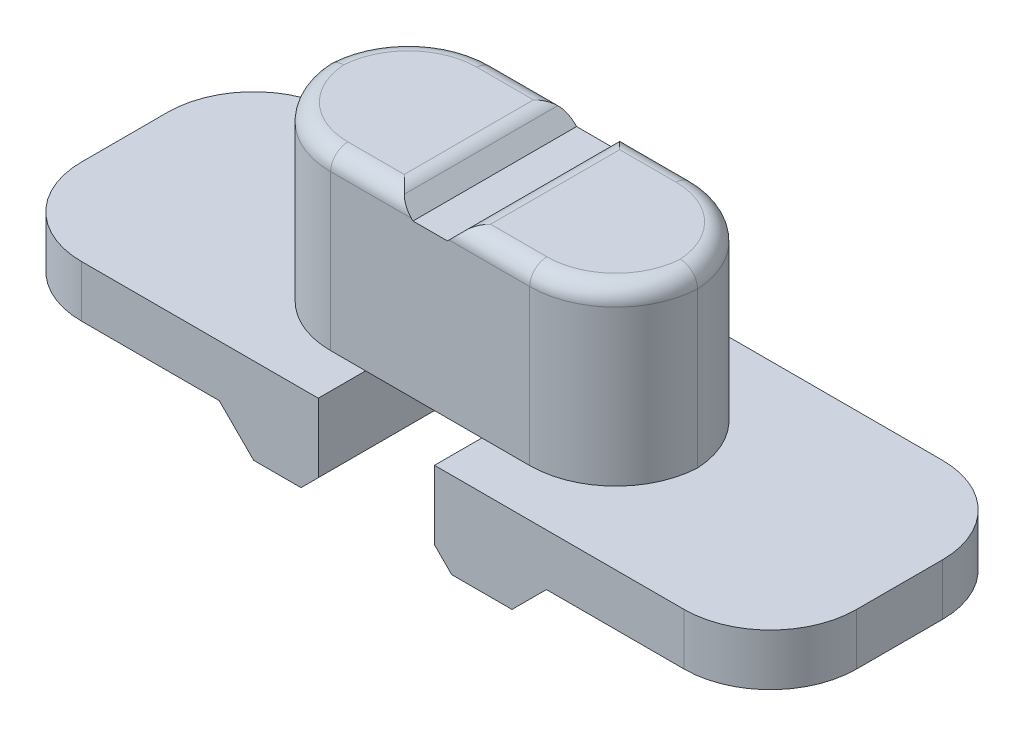
from build123d import *

# Parameters (mm, degrees)
SKETCH_1_W                      = 9
SKETCH_1_H                      = 3
EXTRUDE_1_DEPTH                 = 0.6
SKETCH_2_W                      = 4.311420348
SKETCH_2_H                      = 1.9
EXTRUDE_2_DEPTH                 = 2
FILLET_1_R                      = 1
SKETCH_3_W                      = 3
SKETCH_3_H                      = 3
EXTRUDE_3_DEPTH                 = 0.4
CHAMFER_1_SIZE                  = 0.4
CUT_EXTRUDE_1_REACH             = 8.365
SKETCH_5_W                      = 1.35
SKETCH_5_H                      = 1
CHAMFER_2_SIZE                  = 0.2
CUT_EXTRUDE_2_REACH             = 8.125
SKETCH_7_W                      = 1
SKETCH_7_H                      = 0.436396564
CUT_EXTRUDE_2_DIRECTION_2_DEPTH = 7.124593071
CHAMFER_3_SIZE                  = 0.3
FILLET_2_R                      = 0.2


# Some blends are built 0.0001 mm under size
with BuildPart() as part:
    # 草图1 → 凸台-拉伸1 (new body)
    with BuildSketch(Plane(origin=(0, 0, 0), x_dir=(1, 0, 0), z_dir=(0, 1, 0))):
        with Locations((0.474750274, 0.443619988)):
            Rectangle(SKETCH_1_W, SKETCH_1_H)
    extrude(amount=EXTRUDE_1_DEPTH)

    # 草图2 → 凸台-拉伸2 (add)
    with BuildSketch(Plane(origin=(0, 0.6, 0), x_dir=(1, 0, 0), z_dir=(0, 1, 0))):
        with Locations((0.474750274, 0.443619988)):
            Rectangle(SKETCH_2_W, SKETCH_2_H)
    extrude(amount=EXTRUDE_2_DEPTH)

    # 圆角1
    # the kernel refuses this fillet: 1 mm, written as the material it takes off along each edge
    with BuildSketch(Plane(origin=(-4.025249726, -2.5, 1.056380012), x_dir=(0, 0, -1), z_dir=(0, 1, 0)), Plane(origin=(-4.025249726, -2.5, -1.943619988), x_dir=(1, 0, 0), z_dir=(0, 1, 0))) as fillet_1_piece_1:
        with BuildLine():
            CenterArc((FILLET_1_R, -FILLET_1_R), FILLET_1_R, 90, 90)
            Line((0, -FILLET_1_R), (0, 0))
            Line((0, 0), (FILLET_1_R, 0))
        make_face()
    extrude(amount=5.6, mode=Mode.SUBTRACT)
    with BuildSketch(Plane(origin=(-1.6809599, 0.6, 0.506380012), x_dir=(1, 0, 0), z_dir=(0, 1, 0)), Plane(origin=(2.630460448, 0.6, 0.506380012), x_dir=(0, 0, -1), z_dir=(0, 1, 0)), Plane(origin=(2.630460448, 0.6, -1.393619988), x_dir=(-1, 0, 0), z_dir=(0, 1, 0))) as fillet_1_piece_2:
        with BuildLine():
            CenterArc((FILLET_1_R, FILLET_1_R), FILLET_1_R, 180, 90)
            Line((0, FILLET_1_R), (0, 0))
            Line((0, 0), (FILLET_1_R, 0))
        make_face()
    extrude(amount=4.5, mode=Mode.SUBTRACT)
    with BuildSketch(Plane(origin=(4.974750274, -2.5, 1.056380012), x_dir=(0, 0, -1), z_dir=(0, 1, 0)), Plane(origin=(4.974750274, -2.5, -1.943619988), x_dir=(-1, 0, 0), z_dir=(0, 1, 0))) as fillet_1_piece_3:
        with BuildLine():
            CenterArc((FILLET_1_R, FILLET_1_R), FILLET_1_R, 180, 90)
            Line((0, FILLET_1_R), (0, 0))
            Line((0, 0), (FILLET_1_R, 0))
        make_face()
    extrude(amount=5.6, mode=Mode.SUBTRACT)
    with BuildSketch(Plane(origin=(-1.6809599, 0.6, -1.393619988), x_dir=(1, 0, 0), z_dir=(0, 1, 0))) as fillet_1_piece_4:
        with BuildLine():
            CenterArc((FILLET_1_R, -FILLET_1_R), FILLET_1_R, 90, 90)
            Line((0, -FILLET_1_R), (0, 0))
            Line((0, 0), (FILLET_1_R, 0))
        make_face()
    extrude(amount=4.5, mode=Mode.SUBTRACT)

    # 草图3 → 凸台-拉伸3 (add)
    with BuildSketch(Plane.XZ):
        with Locations((0.474750274, -0.443619988)):
            Rectangle(SKETCH_3_W, SKETCH_3_H)
    extrude(amount=EXTRUDE_3_DEPTH)

    # 倒角1
    chamfer_1_edges = [part.edges().sort_by_distance(p)[0] for p in [
        (1.974750274, 0, -0.443619988),
        (-1.025249726, 0, -0.443619988),
    ]]
    chamfer(chamfer_1_edges, length=CHAMFER_1_SIZE - 0.0001)  # a hair under: the kernel refuses the full size

    # 草图5 → 切除-拉伸1 (cut, up to next)
    with BuildSketch(Plane(origin=(0, 0, -1.943619988), x_dir=(-1, 0, 0), z_dir=(0, 0, -1)), mode=Mode.PRIVATE) as cut_extrude_1_sk1:
        with Locations((-0.399750274, 0.1)):
            Rectangle(SKETCH_5_W, SKETCH_5_H)
    cut_extrude_1_tool1 = extrude(cut_extrude_1_sk1.sketch, amount=-CUT_EXTRUDE_1_REACH, mode=Mode.PRIVATE) & part.part
    add(cut_extrude_1_tool1.solids().sort_by_distance((0.39975, 0.1, -1.94362))[0], mode=Mode.SUBTRACT)

    # 倒角2
    chamfer_2_edges = [part.edges().sort_by_distance(p)[0] for p in [
        (-0.275249726, -0.4, -0.443619988),
        (1.074750274, -0.4, -0.443619988),
    ]]
    chamfer(chamfer_2_edges, length=CHAMFER_2_SIZE)

    # 草图7 → 切除-拉伸2 (cut, up to next)
    with BuildSketch(Plane.XY.offset(0.506380012), mode=Mode.PRIVATE) as cut_extrude_2_sk1:
        with Locations((0.474750274, 2.6)):
            Rectangle(SKETCH_7_W, SKETCH_7_H)
    cut_extrude_2_tool1 = extrude(cut_extrude_2_sk1.sketch, amount=-CUT_EXTRUDE_2_REACH, mode=Mode.PRIVATE) & part.part
    add(cut_extrude_2_tool1.solids().sort_by_distance((0.47475, 2.6, 0.50638))[0], mode=Mode.SUBTRACT)

    # 草图7 → 切除-拉伸2 direction 2 (cut)
    with BuildSketch(Plane.XY.offset(0.506380012)):
        with Locations((0.474750274, 2.6)):
            Rectangle(SKETCH_7_W, SKETCH_7_H)
    extrude(amount=CUT_EXTRUDE_2_DIRECTION_2_DEPTH, mode=Mode.SUBTRACT)

    # 倒角3
    # the kernel refuses this chamfer: 0.3 mm, written as the material it adds along each edge
    with BuildSketch(Plane(origin=(0.974750274, 2.381801718, 0.506380012), x_dir=(-0.9996219169112968, -0.027495876610585914, 0), z_dir=(0, 0, -1))) as chamfer_3_piece_1_section:
        Polygon((CHAMFER_3_SIZE * 0.999621916911, CHAMFER_3_SIZE * 0.0274958766106), (-CHAMFER_3_SIZE * 0.0274958766106, CHAMFER_3_SIZE * 0.999621916911), (0, 0), align=None)
    chamfer_3_piece_1 = extrude(amount=1.9, mode=Mode.PRIVATE)
    chamfer_3_piece_1 = split(chamfer_3_piece_1, bisect_by=Plane(origin=(0.868236274, 2.6, -0.443619988), z_dir=(0, -1, 0)), keep=Keep.TOP, mode=Mode.PRIVATE)
    add(chamfer_3_piece_1)
    with BuildSketch(Plane(origin=(-0.025249726, 2.381801718, 0.506380012), x_dir=(-0.027495876610586414, 0.9996219169112968, 0), z_dir=(0, 0, -1))) as chamfer_3_piece_2_section:
        Polygon((CHAMFER_3_SIZE * 0.999621916911, CHAMFER_3_SIZE * 0.0274958766106), (-CHAMFER_3_SIZE * 0.0274958766106, CHAMFER_3_SIZE * 0.999621916911), (0, 0), align=None)
    chamfer_3_piece_2 = extrude(amount=1.9, mode=Mode.PRIVATE)
    chamfer_3_piece_2 = split(chamfer_3_piece_2, bisect_by=Plane(origin=(0.081264274, 2.6, -0.443619988), z_dir=(0, -1, 0)), keep=Keep.TOP, mode=Mode.PRIVATE)
    add(chamfer_3_piece_2)

    # 圆角2
    # the kernel refuses this fillet: 0.2 mm, written as the material it takes off along each edge
    with BuildSketch(Plane(origin=(1.630460448, 2.6, 0.506380012), x_dir=(0, 0, -1), z_dir=(-1, 0, 0)), Plane(origin=(-0.6809599, 2.6, -1.393619988), x_dir=(0, 0, 1), z_dir=(1, 0, 0)), Plane(origin=(0.556551992, 2.6, 0.506380012), x_dir=(0, 0, -1), z_dir=(-1, 0, 0))) as fillet_2_piece_1:
        with BuildLine():
            CenterArc((FILLET_2_R, FILLET_2_R), FILLET_2_R, 180, 90)
            Line((0, FILLET_2_R), (0, 0))
            Line((0, 0), (FILLET_2_R, 0))
        make_face()
    extrude(amount=1.237511893, mode=Mode.SUBTRACT)
    with BuildSketch(Plane(origin=(0.892948555, 2.6, 0.713486793), x_dir=(1, 0, 0), z_dir=(0, 0, -1))) as fillet_2_piece_2:
        with BuildLine():
            CenterArc((FILLET_2_R * 0.414213562373, FILLET_2_R), FILLET_2_R, 225, 45)
            Line((-FILLET_2_R * 0.292893218814, FILLET_2_R * 0.292893218814), (0, 0))
            Line((0, 0), (FILLET_2_R * 0.414213562373, 0))
        make_face()
    extrude(amount=2.314213562, mode=Mode.SUBTRACT)
    with BuildSketch(Plane(origin=(0.056551992, 2.6, -1.60072677), x_dir=(0.7071067811868288, -0.7071067811862661, 0), z_dir=(0, 0, 1))) as fillet_2_piece_3:
        with BuildLine():
            CenterArc((FILLET_2_R * 0.414213562373, -FILLET_2_R), FILLET_2_R, 90, 45)
            Line((-FILLET_2_R * 0.292893218813, -FILLET_2_R * 0.292893218813), (0, 0))
            Line((0, 0), (FILLET_2_R * 0.414213562373, 0))
        make_face()
    extrude(amount=2.314213562, mode=Mode.SUBTRACT)
    with BuildSketch(Plane(origin=(1.630460448, 2.6, -1.393619988), x_dir=(0, 0, 1), z_dir=(-1, 0, 0))) as fillet_2_piece_4:
        with BuildLine():
            CenterArc((FILLET_2_R, -FILLET_2_R), FILLET_2_R, 90, 90)
            Line((0, -FILLET_2_R), (0, 0))
            Line((0, 0), (FILLET_2_R, 0))
        make_face()
    extrude(amount=1.237511893, mode=Mode.SUBTRACT)
    with BuildSketch(Plane(origin=(1.630460448, 2.6, -0.393619988), x_dir=(0, 0, -1), z_dir=(-1, 0, 0))) as fillet_2_piece_5:
        with BuildLine():
            CenterArc((1 - FILLET_2_R, FILLET_2_R), FILLET_2_R, 270, 90)
            Line((1, FILLET_2_R), (1, 0))
            Line((1, 0), (1 - FILLET_2_R, 0))
        make_face()
    revolve(axis=Axis((1.630460448, 2.6, -0.393619988), (0, -1, 0)), revolution_arc=115.792692411, mode=Mode.SUBTRACT)
    with BuildSketch(Plane(origin=(1.630460448, 2.6, -0.493619988), x_dir=(0.9003742740999041, 0, -0.4351162678400692), z_dir=(-0.4351162678400692, 0, -0.9003742740999041))) as fillet_2_piece_6:
        with BuildLine():
            CenterArc((1 - FILLET_2_R, FILLET_2_R), FILLET_2_R, 270, 90)
            Line((1 - FILLET_2_R, 0), (1, 0))
            Line((1, 0), (1, FILLET_2_R))
        make_face()
    revolve(axis=Axis((1.630460448, 2.6, -0.493619988), (0, -1, 0)), revolution_arc=115.792692411, mode=Mode.SUBTRACT)
    with BuildSketch(Plane(origin=(-0.6809599, 2.6, -0.393619988), x_dir=(-0.9003742740999052, 0, 0.43511626784006674), z_dir=(0.43511626784006674, 0, 0.9003742740999052))) as fillet_2_piece_7:
        with BuildLine():
            CenterArc((1 - FILLET_2_R, FILLET_2_R), FILLET_2_R, 270, 90)
            Line((1, FILLET_2_R), (1, 0))
            Line((1, 0), (1 - FILLET_2_R, 0))
        make_face()
    revolve(axis=Axis((-0.6809599, 2.6, -0.393619988), (0, -1, 0)), revolution_arc=115.792692411, mode=Mode.SUBTRACT)
    with BuildSketch(Plane(origin=(-0.6809599, 2.6, -0.493619988), x_dir=(0, 0, 1), z_dir=(1, 0, 0))) as fillet_2_piece_8:
        with BuildLine():
            CenterArc((1 - FILLET_2_R, FILLET_2_R), FILLET_2_R, 270, 90)
            Line((1, FILLET_2_R), (1, 0))
            Line((1, 0), (1 - FILLET_2_R, 0))
        make_face()
    revolve(axis=Axis((-0.6809599, 2.6, -0.493619988), (0, -1, 0)), revolution_arc=115.792692411, mode=Mode.SUBTRACT)


solid = part.part
